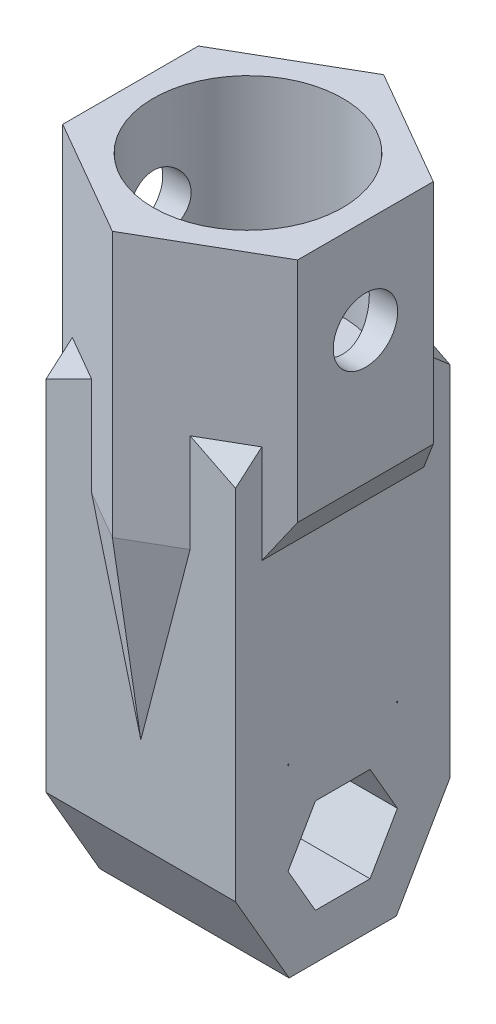
from build123d import *

# Parameters (mm, degrees)
SALIENTE_EXTRUIR1_DEPTH      = 5
SALIENTE_EXTRUIR1_DEPTH_BACK = 5
SALIENTE_EXTRUIR2_START      = 14
CROQUIS2_R                   = 5
SALIENTE_EXTRUIR2_DEPTH      = 10
CROQUIS4_W                   = 10
CROQUIS4_H                   = 2.771281292
SALIENTE_EXTRUIR3_DEPTH      = 18.9
CHAFL_N1_SIZE                = 1.2
CROQUIS5_R                   = 1.7
CORTAR_EXTRUIR1_DEPTH        = 33.252493444
CROQUIS2_4_R                 = 5
SALIENTE_EXTRUIR8_DEPTH      = 14
CHAFL_N2_SIZE                = 10
CHAFL_N2_SIZE_2              = 1.3
CORTAR_EXTRUIR2_DEPTH        = 31.412223535
CORTAR_EXTRUIR2_DEPTH_BACK   = 31.412223535


# Some blends are built 0.0001 mm under size
with BuildPart() as part:
    # Croquis1 → Saliente-Extruir1 (new, two sides: drawn at the far end of the back side and taken through both)
    with BuildSketch(Plane(origin=(0, 0, 0), x_dir=(0, 0, -1), z_dir=(1, 0, 0)).offset(-SALIENTE_EXTRUIR1_DEPTH_BACK)):
        Polygon((2.829016319, 4.9), (-2.829016319, 4.9), (-5.658032638, 0), (-2.829016319, -4.9), (2.829016319, -4.9), (5.658032638, 0), align=None)
        Polygon((2.886751346, 0), (1.443375673, 2.5), (-1.443375673, 2.5), (-2.886751346, 0), (-1.443375673, -2.5), (1.443375673, -2.5), align=None, mode=Mode.SUBTRACT)
    extrude(amount=SALIENTE_EXTRUIR1_DEPTH + SALIENTE_EXTRUIR1_DEPTH_BACK)



with BuildPart() as body_2:
    # Croquis2 → Saliente-Extruir2 (new body)
    with BuildSketch(Plane(origin=(0, 4.9, 0), x_dir=(1, 0, 0), z_dir=(0, 1, 0)).offset(SALIENTE_EXTRUIR2_START)):
        Polygon((0, 7.159143338), (-6.2, 3.579571669), (-6.2, -3.579571669), (0, -7.159143338), (6.2, -3.579571669), (6.2, 3.579571669), align=None)
        with Locations(Location((0, 0, 0), (0, 0, 270))):
            Circle(CROQUIS2_R, mode=Mode.SUBTRACT)
    extrude(amount=SALIENTE_EXTRUIR2_DEPTH)


with BuildPart() as part_1:
    add(part.part)

    add(body_2.part)  # Saliente-Extruir3 merges body 2
    # Croquis4 → Saliente-Extruir3 (add)
    with BuildSketch(Plane(origin=(0, 0, 0), x_dir=(1, 0, 0), z_dir=(0, 1, 0))):
        with Locations((0, -4.272391992)):
            Rectangle(CROQUIS4_W, CROQUIS4_H)
        with Locations((0, 4.272391992)):
            Rectangle(CROQUIS4_W, CROQUIS4_H)
    extrude(amount=SALIENTE_EXTRUIR3_DEPTH)

    # Chaflán1
    chafl_n1_edges = [part_1.edges().sort_by_distance(p)[0] for p in [
        (3.8, 18.9, 4.965212315),
        (-3.8, 18.9, 4.965212315),
        (-3.8, 18.9, -4.965212315),
        (3.8, 18.9, -4.965212315),
    ]]
    chamfer(chafl_n1_edges, length=CHAFL_N1_SIZE - 0.0001)  # a hair under: the kernel refuses the full size

    # Croquis5 → Cortar-Extruir1 (cut, through all)
    with BuildSketch(Plane(origin=(6.2, 0, 0), x_dir=(0, 0, -1), z_dir=(1, 0, 0))):
        with Locations((0, 23.9)):
            Circle(CROQUIS5_R)
    extrude(amount=-CORTAR_EXTRUIR1_DEPTH, mode=Mode.SUBTRACT)

    # Croquis2<4> → Saliente-Extruir8 (add)
    # profile 1 of 2: a face of its own
    with BuildSketch(Plane(origin=(0, 4.9, 0), x_dir=(1, 0, 0), z_dir=(0, 1, 0))):
        Polygon((6.2, -3.579571669), (6.2, 3.579571669), (0, 7.159143338), (-6.2, 3.579571669), (-6.2, -3.579571669), (0, -7.159143338), align=None)
        with Locations(Location((0, 0, 0), (0, 0, 270))):
            Circle(CROQUIS2_4_R, mode=Mode.SUBTRACT)
    # profile 2 of 2: a face of its own
    with BuildSketch(Plane(origin=(0, 4.9, 0), x_dir=(1, 0, 0), z_dir=(0, 1, 0))):
        with Locations(Location((0, 0, 0), (0, 0, 270))):
            Circle(CROQUIS2_4_R)
    extrude(amount=SALIENTE_EXTRUIR8_DEPTH)

    # Chaflán2
    # the kernel refuses this chamfer: 10, 1.3 mm, written as the material it takes off along each edge
    with BuildSketch(Plane(origin=(-25.109710919, 4.9, -7.33795502), x_dir=(-0.00247990444519022, 0.9999877000722412, 0.004295320496985479), z_dir=(0.8660254037844387, 0, 0.5000000000000001))) as chafl_n2_piece_1_section:
        Polygon((CHAFL_N2_SIZE * 0.999987700072, -CHAFL_N2_SIZE * 0.00495980889038), (-CHAFL_N2_SIZE_2 * 0.00495980889038, -CHAFL_N2_SIZE_2 * 0.999987700072), (0, 0), align=None)
    chafl_n2_piece_1 = extrude(amount=54.986172033, mode=Mode.PRIVATE)
    chafl_n2_piece_1 = split(chafl_n2_piece_1, bisect_by=Plane(origin=(-0.715, 8.4, 5.658032638), z_dir=(0, 0, 1)), keep=Keep.TOP, mode=Mode.PRIVATE)
    add(chafl_n2_piece_1, mode=Mode.SUBTRACT)
    with BuildSketch(Plane(origin=(-22.509710919, 4.9, 20.155130996), x_dir=(-0.47976503705991164, -0.28160617333362153, -0.8309774198829328), z_dir=(0.8660254037844388, 0, -0.49999999999999967))) as chafl_n2_piece_2_section:
        Polygon((CHAFL_N2_SIZE_2 * 0.95953007412, CHAFL_N2_SIZE_2 * 0.281606173334), (-CHAFL_N2_SIZE * 0.281606173334, CHAFL_N2_SIZE * 0.95953007412), (0, 0), align=None)
    chafl_n2_piece_2 = extrude(amount=54.986172033, mode=Mode.PRIVATE)
    chafl_n2_piece_2 = split(chafl_n2_piece_2, bisect_by=Plane(origin=(0.715, 8.4, 5.658032638), z_dir=(0, 0, 1)), keep=Keep.TOP, mode=Mode.PRIVATE)
    add(chafl_n2_piece_2, mode=Mode.SUBTRACT)
    with BuildSketch(Plane(origin=(22.509710919, 4.9, -20.155130996), x_dir=(-0.002479904445190118, 0.9999877000722412, -0.004295320496985084), z_dir=(-0.8660254037844387, 0, 0.49999999999999994))) as chafl_n2_piece_3_section:
        Polygon((CHAFL_N2_SIZE * 0.999987700072, -CHAFL_N2_SIZE * 0.00495980889038), (-CHAFL_N2_SIZE_2 * 0.00495980889038, -CHAFL_N2_SIZE_2 * 0.999987700072), (0, 0), align=None)
    chafl_n2_piece_3 = extrude(amount=54.986172033, mode=Mode.PRIVATE)
    chafl_n2_piece_3 = split(chafl_n2_piece_3, bisect_by=Plane(origin=(-0.715, 8.4, -5.658032638), z_dir=(0, 0, -1)), keep=Keep.TOP, mode=Mode.PRIVATE)
    add(chafl_n2_piece_3, mode=Mode.SUBTRACT)
    with BuildSketch(Plane(origin=(25.109710919, 4.9, 7.33795502), x_dir=(-0.4797650370599119, -0.28160617333362137, 0.8309774198829327), z_dir=(-0.8660254037844387, 0, -0.5000000000000001))) as chafl_n2_piece_4_section:
        Polygon((CHAFL_N2_SIZE_2 * 0.95953007412, CHAFL_N2_SIZE_2 * 0.281606173334), (-CHAFL_N2_SIZE * 0.281606173334, CHAFL_N2_SIZE * 0.95953007412), (0, 0), align=None)
    chafl_n2_piece_4 = extrude(amount=54.986172033, mode=Mode.PRIVATE)
    chafl_n2_piece_4 = split(chafl_n2_piece_4, bisect_by=Plane(origin=(0.715, 8.4, -5.658032638), z_dir=(0, 0, -1)), keep=Keep.TOP, mode=Mode.PRIVATE)
    add(chafl_n2_piece_4, mode=Mode.SUBTRACT)

    # Croquis6 → Cortar-Extruir2 (cut, two sides: drawn at the far end of the back side and taken through both)
    with BuildSketch(Plane.XY.offset(-CORTAR_EXTRUIR2_DEPTH_BACK)):
        Polygon((5, 14.9), (6.2, 16.9), (6.2, 4.9), (5, 4.9), align=None)
        Polygon((-6.2, 4.9), (-5, 4.9), (-5, 14.9), (-6.2, 16.9), align=None)
    extrude(amount=CORTAR_EXTRUIR2_DEPTH + CORTAR_EXTRUIR2_DEPTH_BACK, mode=Mode.SUBTRACT)


solid = part_1.part
